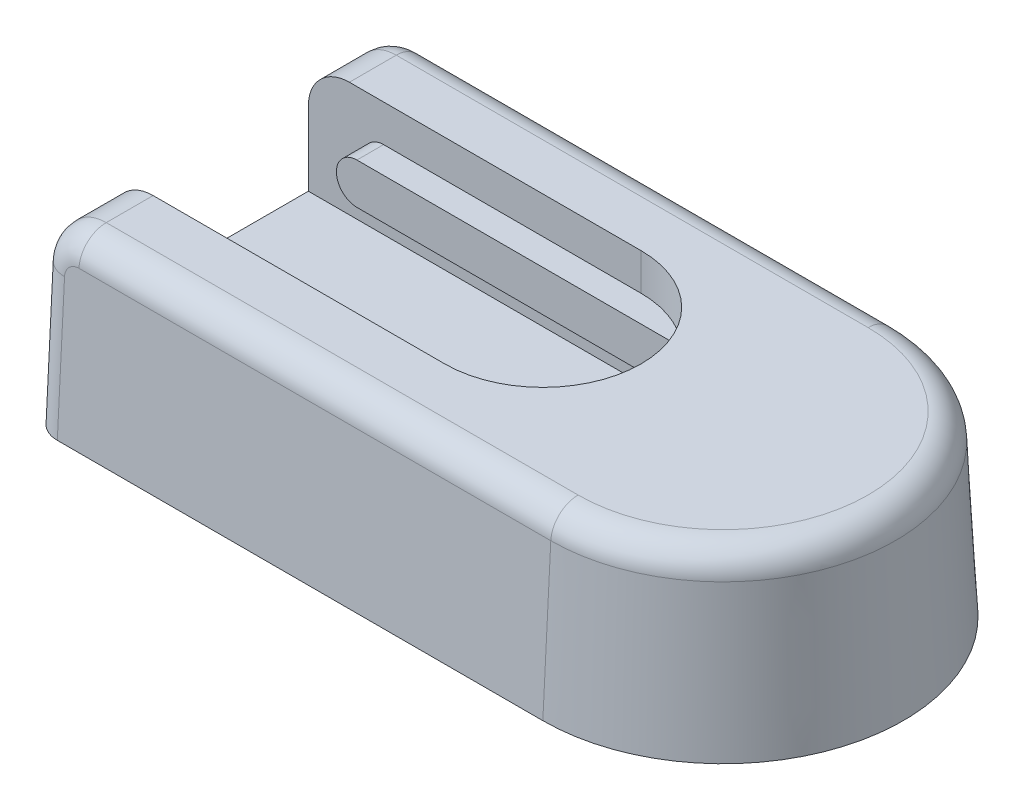
from build123d import *

# Parameters (mm, degrees)
BOSS_EXTRUDE1_DEPTH = 13
CUT_EXTRUDE1_DEPTH  = 8.4
BOSS_EXTRUDE3_START = 5.7
BOSS_EXTRUDE3_DEPTH = 3
FILLET1_R           = 1.5
DRAFT2_ANGLE        = 3
FILLET2_R           = 3
FILLET3_R           = 2


with BuildPart() as part:
    # Sketch1 → Boss-Extrude1 (new body)
    with BuildSketch(Plane(origin=(0, 0, 0), x_dir=(1, 0, 0), z_dir=(0, 1, 0))):
        with BuildLine():
            Line((0, 0), (37.5, 0))
            ThreePointArc((37.5, 0), (50, 12.5), (37.5, 25))
            Line((37.5, 25), (0, 25))
            Line((0, 25), (0, 0))
        make_face()
    extrude(amount=BOSS_EXTRUDE1_DEPTH)

    # Sketch2 → Cut-Extrude1 (cut)
    with BuildSketch(Plane(origin=(0, 13, 0), x_dir=(1, 0, 0), z_dir=(0, 1, 0))):
        with BuildLine():
            Line((24.325, 19.675), (0, 19.675))
            Line((0, 19.675), (0, 5.325))
            Line((0, 5.325), (24.325, 5.325))
            ThreePointArc((24.325, 5.325), (31.5, 12.5), (24.325, 19.675))
        make_face()
    extrude(amount=-CUT_EXTRUDE1_DEPTH, mode=Mode.SUBTRACT)

    # Sketch3 → Boss-Extrude3 (add)
    with BuildSketch(Plane(origin=(0, 4.6, 0), x_dir=(1, 0, 0), z_dir=(0, 1, 0)).offset(BOSS_EXTRUDE3_START)):
        with BuildLine():
            Line((4, 5.325), (24.325, 5.325))
            ThreePointArc((24.325, 5.325), (26.969924385, 5.83029236), (29.242316341, 7.275))
            Line((29.242316341, 7.275), (4, 7.275))
            Line((4, 7.275), (4, 5.325))
        make_face()
        with BuildLine():
            Line((4, 19.675), (24.325, 19.675))
            ThreePointArc((24.325, 19.675), (26.969924385, 19.16970764), (29.242316341, 17.725))
            Line((29.242316341, 17.725), (4, 17.725))
            Line((4, 17.725), (4, 19.675))
        make_face()
    extrude(amount=-BOSS_EXTRUDE3_DEPTH)

    # Fillet1
    fillet1_edges = [part.edges().sort_by_distance(p)[0] for p in [
        (4, 7.3, -6.3),
        (4, 10.3, -6.3),
        (4, 7.3, -18.7),
        (4, 10.3, -18.7),
    ]]
    fillet(fillet1_edges, radius=FILLET1_R - 0.0001)  # a hair under: the kernel refuses the full size

    # Draft2
    draft2_faces = [part.faces().sort_by_distance(p)[0] for p in [
        (18.75, 6.5, -25),
        (50, 6.5, -12.5),
        (18.75, 6.5, 0),
    ]]
    draft(draft2_faces, Plane(origin=(37.5, 13, -12.5), x_dir=(0, 0, 1), z_dir=(0, 1, 0)), DRAFT2_ANGLE)

    # Fillet2
    fillet2_edges = [part.edges().sort_by_distance(p)[0] for p in [
        (0, 13, -2.6625),
        (0, 13, -22.3375),
    ]]
    fillet(fillet2_edges, radius=FILLET2_R)

    # Fillet3
    fillet3_edges = [part.edges().sort_by_distance(p)[0] for p in [
        (50, 13, -12.5),
        (20.25, 13, -25),
        (20.25, 13, 0),
        (0, 5, -25.419262234),
        (0, 5, 0.419262234),
        (0.877952484, 12.120592922, -25.046087772),
        (0.877952484, 12.120592922, 0.046087772),
    ]]
    fillet(fillet3_edges, radius=FILLET3_R)


solid = part.part
